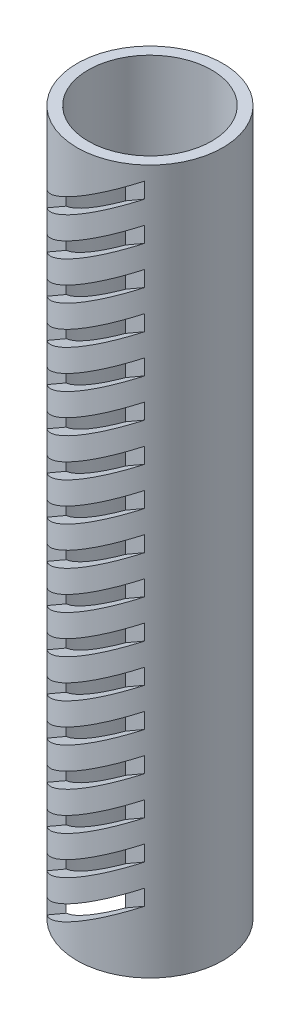
from build123d import *

# Parameters (mm, degrees)
SKETCH1_R           = 25.654
SKETCH1_R_2         = 21.717
BOSS_EXTRUDE1_DEPTH = 247.65
CUT_EXTRUDE1_START  = 19.05
CUT_EXTRUDE1_DEPTH  = 12.7
LPATTERN1_COUNT     = 17
LPATTERN1_PITCH     = 13.462


with BuildPart() as part:
    # Sketch1 → Boss-Extrude1 (new body)
    with BuildSketch(Plane(origin=(0, 0, 0), x_dir=(1, 0, 0), z_dir=(0, 1, 0))):
        Circle(SKETCH1_R)
        Circle(SKETCH1_R_2, mode=Mode.SUBTRACT)
    extrude(amount=BOSS_EXTRUDE1_DEPTH)

    # Sketch2 → Cut-Extrude1 (cut)
    with BuildSketch(Plane.XY.offset(CUT_EXTRUDE1_START)):
        Polygon((-28.03525, 216.65249706), (-25.654, 212.528051074), (28.03525, 243.525554014), (25.654, 247.65), align=None)
    cut_extrude1 = extrude(amount=CUT_EXTRUDE1_DEPTH, mode=Mode.SUBTRACT)

    # LPattern1: Cut-Extrude1 ×17
    with Locations(*[(0, -i * LPATTERN1_PITCH, 0) for i in range(1, LPATTERN1_COUNT)]):
        add(cut_extrude1, mode=Mode.SUBTRACT)


solid = part.part
